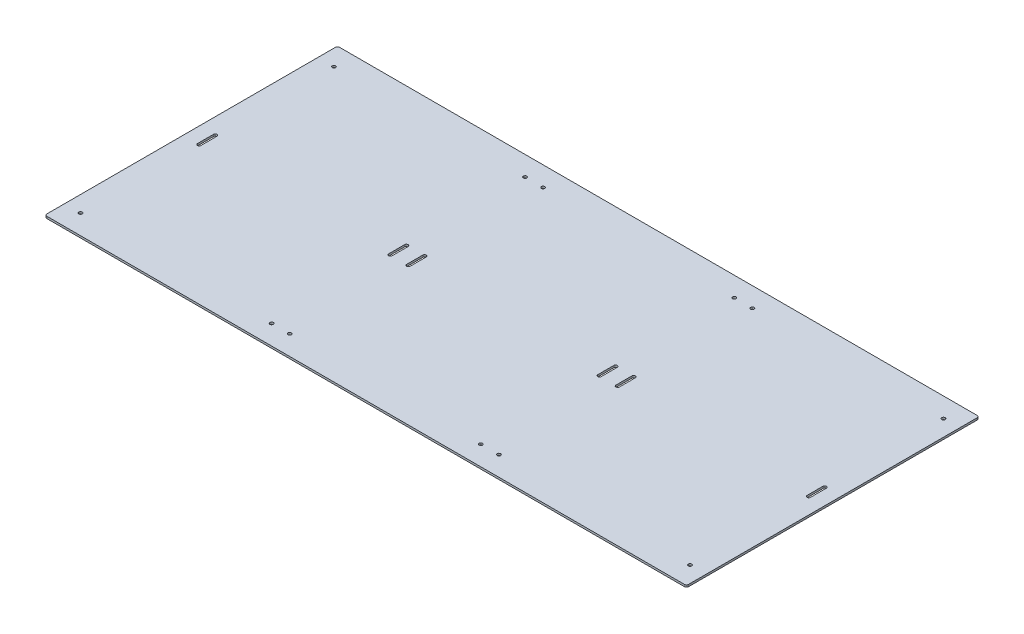
from build123d import *

# Parameters (mm, degrees)
SKETCH1_R           = 5.3578125
BOSS_EXTRUDE1_DEPTH = 6.35


with BuildPart() as part:
    # Sketch1 → Boss-Extrude1 (new body)
    with BuildSketch(Plane(origin=(0, 0, 0), x_dir=(1, 0, 0), z_dir=(0, 1, 0))):
        with BuildLine():
            Line((6.35, 0), (2019.3, 0))
            ThreePointArc((2019.3, 0), (2023.790128061, 1.859871939), (2025.65, 6.35))
            Line((2025.65, 6.35), (2025.65, 917.575))
            ThreePointArc((2025.65, 917.575), (2023.790128061, 922.065128061), (2019.3, 923.925))
            Line((2019.3, 923.925), (6.35, 923.925))
            ThreePointArc((6.35, 923.925), (1.859871939, 922.065128061), (0, 917.575))
            Line((0, 917.575), (0, 6.35))
            ThreePointArc((0, 6.35), (1.859871939, 1.859871939), (6.35, 0))
        make_face()
        with Locations((50.8, 862.0125)):
            Circle(SKETCH1_R, mode=Mode.SUBTRACT)
        with Locations((1974.85, 862.0125)):
            Circle(SKETCH1_R, mode=Mode.SUBTRACT)
        with Locations((1974.85, 61.9125)):
            Circle(SKETCH1_R, mode=Mode.SUBTRACT)
        with Locations((50.8, 61.9125)):
            Circle(SKETCH1_R, mode=Mode.SUBTRACT)
        with Locations((654.05, 862.0125)):
            Circle(SKETCH1_R, mode=Mode.SUBTRACT)
        with Locations((1371.6, 862.0125)):
            Circle(SKETCH1_R, mode=Mode.SUBTRACT)
        with Locations((711.2, 862.0125)):
            Circle(SKETCH1_R, mode=Mode.SUBTRACT)
        with Locations((711.2, 61.9125)):
            Circle(SKETCH1_R, mode=Mode.SUBTRACT)
        with Locations((654.05, 61.9125)):
            Circle(SKETCH1_R, mode=Mode.SUBTRACT)
        with Locations((1314.45, 862.0125)):
            Circle(SKETCH1_R, mode=Mode.SUBTRACT)
        with Locations((1314.45, 61.9125)):
            Circle(SKETCH1_R, mode=Mode.SUBTRACT)
        with Locations((1371.6, 61.9125)):
            Circle(SKETCH1_R, mode=Mode.SUBTRACT)
        with BuildLine():
            Line((56.1578125, 487.3625), (56.1578125, 436.5625))
            ThreePointArc((56.1578125, 436.5625), (50.8, 431.2046875), (45.4421875, 436.5625))
            Line((45.4421875, 436.5625), (45.4421875, 487.3625))
            ThreePointArc((45.4421875, 487.3625), (50.8, 492.7203125), (56.1578125, 487.3625))
        make_face(mode=Mode.SUBTRACT)
        with BuildLine():
            Line((659.407827246, 487.3625), (659.407827246, 436.5625))
            ThreePointArc((659.407827246, 436.5625), (654.050014746, 431.2046875), (648.692202246, 436.5625))
            Line((648.692202246, 436.5625), (648.692202246, 487.3625))
            ThreePointArc((648.692202246, 487.3625), (654.050014746, 492.7203125), (659.407827246, 487.3625))
        make_face(mode=Mode.SUBTRACT)
        with BuildLine():
            Line((716.5578125, 487.3625), (716.5578125, 436.5625))
            ThreePointArc((716.5578125, 436.5625), (711.2, 431.2046875), (705.8421875, 436.5625))
            Line((705.8421875, 436.5625), (705.8421875, 487.3625))
            ThreePointArc((705.8421875, 487.3625), (711.2, 492.7203125), (716.5578125, 487.3625))
        make_face(mode=Mode.SUBTRACT)
        with BuildLine():
            Line((1969.4921875, 487.3625), (1969.4921875, 436.5625))
            ThreePointArc((1969.4921875, 436.5625), (1974.85, 431.2046875), (1980.2078125, 436.5625))
            Line((1980.2078125, 436.5625), (1980.2078125, 487.3625))
            ThreePointArc((1980.2078125, 487.3625), (1974.85, 492.7203125), (1969.4921875, 487.3625))
        make_face(mode=Mode.SUBTRACT)
        with BuildLine():
            Line((1309.0921875, 487.3625), (1309.0921875, 436.5625))
            ThreePointArc((1309.0921875, 436.5625), (1314.45, 431.2046875), (1319.8078125, 436.5625))
            Line((1319.8078125, 436.5625), (1319.8078125, 487.3625))
            ThreePointArc((1319.8078125, 487.3625), (1314.45, 492.7203125), (1309.0921875, 487.3625))
        make_face(mode=Mode.SUBTRACT)
        with BuildLine():
            Line((1366.242172754, 487.3625), (1366.242172754, 436.5625))
            ThreePointArc((1366.242172754, 436.5625), (1371.599985254, 431.2046875), (1376.957797754, 436.5625))
            Line((1376.957797754, 436.5625), (1376.957797754, 487.3625))
            ThreePointArc((1376.957797754, 487.3625), (1371.599985254, 492.7203125), (1366.242172754, 487.3625))
        make_face(mode=Mode.SUBTRACT)
    extrude(amount=BOSS_EXTRUDE1_DEPTH)


solid = part.part
